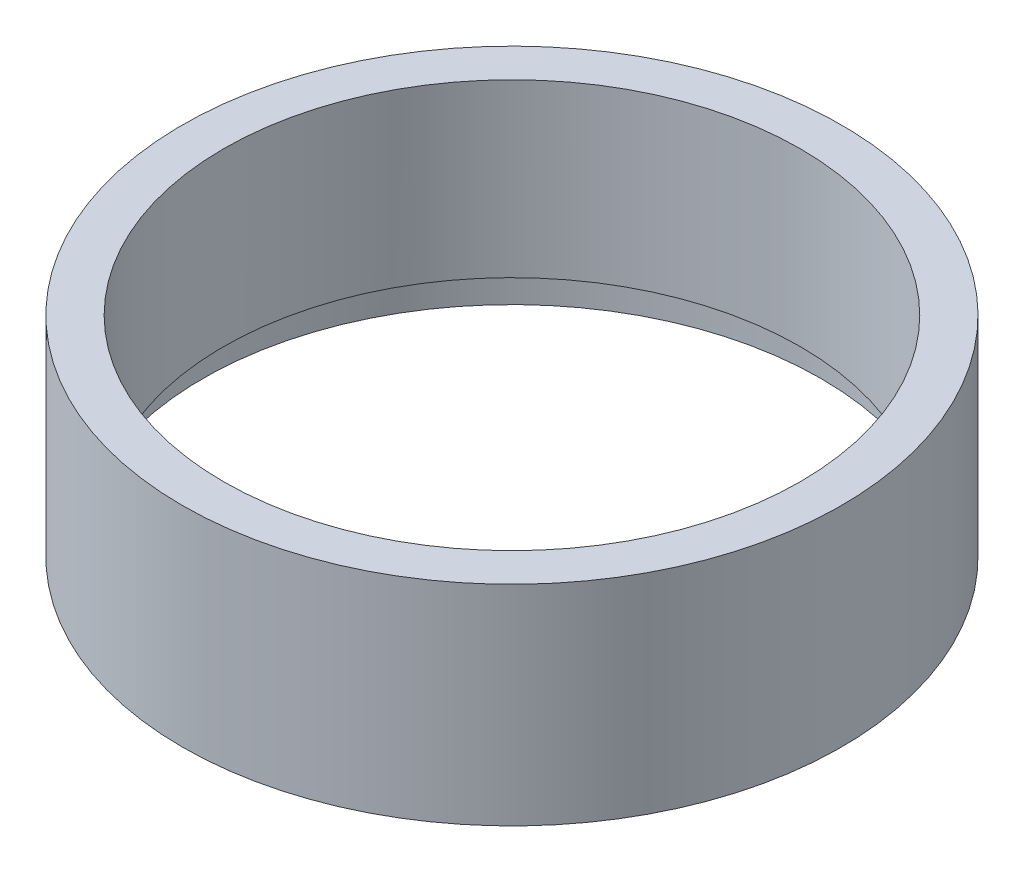
from build123d import *

# Parameters (mm, degrees)
SKETCH1_R           = 40
SKETCH1_R_2         = 35
BOSS_EXTRUDE1_DEPTH = 25.4
SKETCH2_R           = 37.5
SKETCH2_R_2         = 35
CUT_EXTRUDE1_DEPTH  = 4.6


with BuildPart() as part:
    # Sketch1 → Boss-Extrude1 (new body)
    with BuildSketch(Plane(origin=(0, 0, 0), x_dir=(1, 0, 0), z_dir=(0, 1, 0))):
        Circle(SKETCH1_R)
        Circle(SKETCH1_R_2, mode=Mode.SUBTRACT)
    extrude(amount=BOSS_EXTRUDE1_DEPTH)

    # Sketch2 → Cut-Extrude1 (cut)
    with BuildSketch(Plane.XZ):
        Circle(SKETCH2_R)
        Circle(SKETCH2_R_2, mode=Mode.SUBTRACT)
    extrude(amount=-CUT_EXTRUDE1_DEPTH, mode=Mode.SUBTRACT)


solid = part.part
